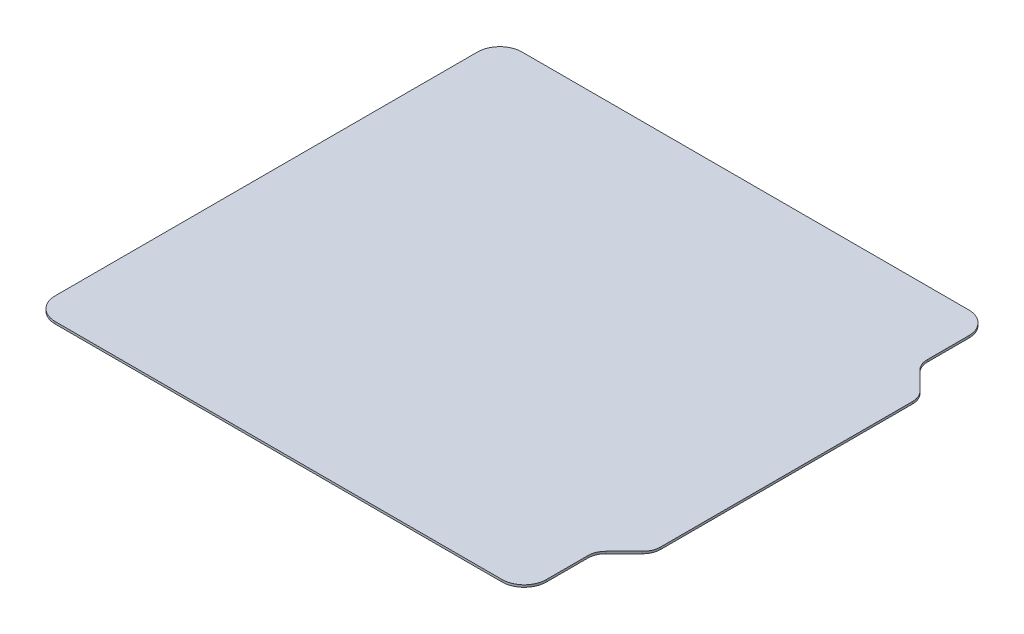
from build123d import *

# Parameters (mm, degrees)
SKETCH1_W           = 234
SKETCH1_H           = 210
BOSS_EXTRUDE1_DEPTH = 1
CUT_EXTRUDE1_DEPTH  = 158.210050569
FILLET1_R           = 8
FILLET2_R           = 10


with BuildPart() as part:
    # Sketch1 → Boss-Extrude1 (new body)
    with BuildSketch(Plane(origin=(0, 0, 0), x_dir=(1, 0, 0), z_dir=(0, 1, 0))):
        Rectangle(SKETCH1_W, SKETCH1_H)
    extrude(amount=BOSS_EXTRUDE1_DEPTH)

    # Sketch2 → Cut-Extrude1 (cut, through all)
    with BuildSketch(Plane(origin=(0, 1, 0), x_dir=(1, 0, 0), z_dir=(0, 1, 0))):
        Polygon((117, 60), (104, 73), (104, 105), (117, 105), align=None)
        Polygon((104, -105), (117, -105), (117, -60), (104, -73), align=None)
    extrude(amount=-CUT_EXTRUDE1_DEPTH, mode=Mode.SUBTRACT)

    # Fillet1
    fillet1_edges = [part.edges().sort_by_distance(p)[0] for p in [
        (104, 0.5, 73),
        (117, 0.5, 60),
        (117, 0.5, -60),
        (104, 0.5, -73),
    ]]
    fillet(fillet1_edges, radius=FILLET1_R)

    # Fillet2
    fillet2_edges = [part.edges().sort_by_distance(p)[0] for p in [
        (-117, 0.5, -105),
        (-117, 0.5, 105),
        (104, 0.5, 105),
        (104, 0.5, -105),
    ]]
    fillet(fillet2_edges, radius=FILLET2_R)


solid = part.part
